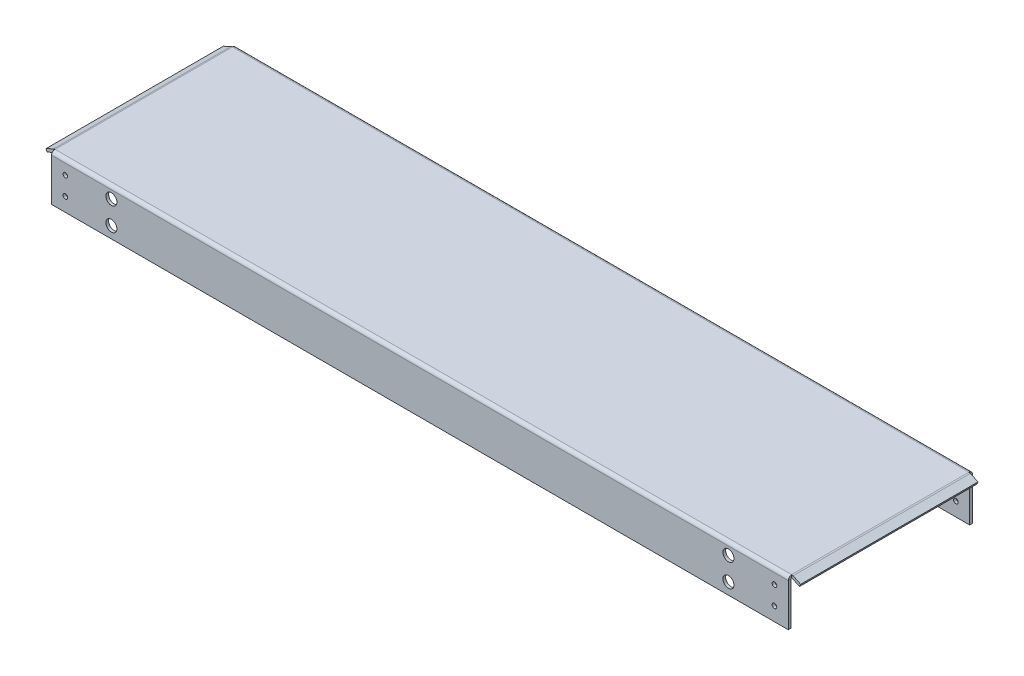
from build123d import *

# Parameters (mm, degrees)
BASE_FLANGE1_DEPTH             = 400
SKETCH6_R                      = 2.5
CUT_EXTRUDE2_DEPTH             = 451
SKETCH10_R                     = 6
CUT_EXTRUDE1_DEPTH             = 451
KENAR_FLAN_1_STRIP_CUT_DEPTH   = 192.5268
KENAR_FLAN_1_STRIP_CUT_2_DEPTH = 192.5268
KENAR_FLAN_1_DEPTH             = 192.5268
KENAR_FLAN_1_BEND_DEPTH        = 192.5268


# Sheet-metal steps are written as plain solids
with BuildPart() as part:
    # Sketch1 → Base-Flange1 (new, symmetric)
    with BuildSketch(Plane(origin=(0, 0, 0), x_dir=(0, 0, -1), z_dir=(1, 0, 0))):
        with BuildLine():
            Line((-100, -50), (-100, -3.7366))
            ThreePointArc((-100, -3.7366), (-98.905575199, -1.094424801), (-96.2634, 0))
            Line((-96.2634, 0), (96.2634, 0))
            ThreePointArc((96.2634, 0), (98.905575199, -1.094424801), (100, -3.7366))
            Line((100, -3.7366), (100, -50))
            Line((100, -50), (97, -50))
            Line((97, -50), (97, -3.7366))
            ThreePointArc((97, -3.7366), (96.784254855, -3.215745145), (96.2634, -3))
            Line((96.2634, -3), (-96.2634, -3))
            ThreePointArc((-96.2634, -3), (-96.784254855, -3.215745145), (-97, -3.7366))
            Line((-97, -3.7366), (-97, -50))
            Line((-97, -50), (-100, -50))
        make_face()
    extrude(amount=BASE_FLANGE1_DEPTH, both=True)

    # Sketch6 → Cut-Extrude2 (cut, through all)
    with BuildSketch(Plane(origin=(0, 0, -100), x_dir=(-1, 0, 0), z_dir=(0, 0, -1))):
        with Locations(Location((-385, -15, 0), (0, 0, 90))):
            Circle(SKETCH6_R)
        with Locations(Location((-385, -35, 0), (0, 0, 90))):
            Circle(SKETCH6_R)
    cut_extrude2 = extrude(amount=-CUT_EXTRUDE2_DEPTH, mode=Mode.SUBTRACT)

    # Sketch10 → Cut-Extrude1 (cut, through all)
    with BuildSketch(Plane(origin=(0, 0, -100), x_dir=(-1, 0, 0), z_dir=(0, 0, -1))):
        with Locations(Location((-335, -12.5, 0), (0, 0, 90))):
            Circle(SKETCH10_R)
        with Locations(Location((-335, -37.5, 0), (0, 0, 90))):
            Circle(SKETCH10_R)
    cut_extrude1 = extrude(amount=-CUT_EXTRUDE1_DEPTH, mode=Mode.SUBTRACT)

    # Kenar-Flanş1 strip (across the edge) → Kenar-Flanş1 strip cut (cut)
    with BuildSketch(Plane(origin=(400, -3, -96.2634), x_dir=(-0.42261826174069383, -0.9063077870366526, 0), z_dir=(0, 0, 1))):
        Polygon((-8.343930041, 10.795010968), (-2.649909677, -1.415855108), (0.069013684, -0.148000323), (-5.62500668, 12.062865753), align=None)
    extrude(amount=KENAR_FLAN_1_STRIP_CUT_DEPTH, mode=Mode.SUBTRACT)

    # Kenar-Flanş1 strip 2 (across the edge) → Kenar-Flanş1 strip cut 2 (cut)
    with BuildSketch(Plane(origin=(-400, -3, 96.2634), x_dir=(0.42261826174069383, -0.9063077870366526, 0), z_dir=(0, 0, -1))):
        Polygon((-8.343930041, 10.795010968), (-2.649909677, -1.415855108), (0.069013684, -0.148000323), (-5.62500668, 12.062865753), align=None)
    extrude(amount=KENAR_FLAN_1_STRIP_CUT_2_DEPTH, mode=Mode.SUBTRACT)

    # Kenar-Flanş1 section (across the edge) → Kenar-Flanş1 (add)
    with BuildSketch(Plane(origin=(400, -3, -96.2634), x_dir=(-0.42261826174069383, -0.9063077870366526, 0), z_dir=(0, 0, 1))):
        with BuildLine():
            Line((-3, 0.163300289), (-3, 9.334916012))
            Line((-3, 9.334916012), (0, 9.334916012))
            Line((0, 9.334916012), (0, 0.163300289))
            ThreePointArc((0, 0.163300289), (0.017460361, 0.003870869), (0.069013684, -0.148000323))
            Line((0.069013684, -0.148000323), (-2.649909677, -1.415855108))
            ThreePointArc((-2.649909677, -1.415855108), (-2.91142766, -0.645447973), (-3, 0.163300289))
        make_face()
    extrude(amount=KENAR_FLAN_1_DEPTH)

    # Kenar-Flanş1 section 2 (across the edge) → Kenar-Flanş1 bend (add)
    with BuildSketch(Plane(origin=(-400, -3, 96.2634), x_dir=(0.42261826174069383, -0.9063077870366526, 0), z_dir=(0, 0, -1))):
        with BuildLine():
            Line((-3, 0.163300289), (-3, 9.334916012))
            Line((-3, 9.334916012), (0, 9.334916012))
            Line((0, 9.334916012), (0, 0.163300289))
            ThreePointArc((0, 0.163300289), (0.017460361, 0.003870869), (0.069013684, -0.148000323))
            Line((0.069013684, -0.148000323), (-2.649909677, -1.415855108))
            ThreePointArc((-2.649909677, -1.415855108), (-2.91142766, -0.645447973), (-3, 0.163300289))
        make_face()
    extrude(amount=KENAR_FLAN_1_BEND_DEPTH)

    # Mirror1: Cut-Extrude2, Cut-Extrude1 across plane
    add(cut_extrude2.mirror(Plane(origin=(0, 0, 0), x_dir=(0, 0, 1), z_dir=(1, 0, 0))), mode=Mode.SUBTRACT)
    add(cut_extrude1.mirror(Plane(origin=(0, 0, 0), x_dir=(0, 0, 1), z_dir=(1, 0, 0))), mode=Mode.SUBTRACT)


solid = part.part
